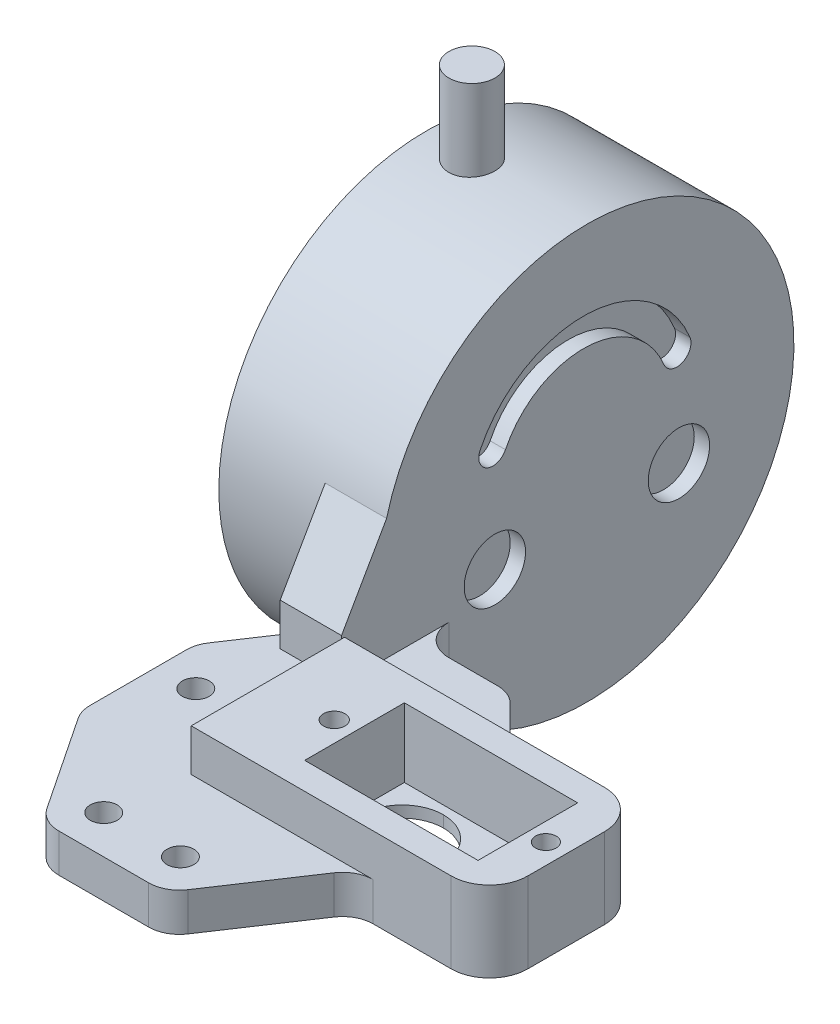
from build123d import *

# Parameters (mm, degrees)
BOSS_EXTRUDE1_DEPTH             = 5
SKETCH2_R                       = 1.75
SKETCH2_W                       = 10.8
SKETCH2_H                       = 10.8
CUT_EXTRUDE1_DEPTH              = 52.722948416
FILLET1_R                       = 5.4
FILLET2_R                       = 5.4
FILLET3_RADIUS                  = 10
FILLET3_LENGTH                  = 5
SKETCH3_W                       = 35
SKETCH3_H                       = 20
SKETCH3_W_2                     = 23
SKETCH3_H_2                     = 13
BOSS_EXTRUDE2_DEPTH             = 5.5
SKETCH4_W                       = 23
SKETCH4_H                       = 13
CUT_EXTRUDE2_DEPTH              = 3.5
CUT_EXTRUDE3_DEPTH              = 52.773674709
FILLET4_R                       = 4
SKETCH6_W                       = 8
SKETCH6_H                       = 28
BOSS_EXTRUDE3_DEPTH             = 32
FILLET5_R                       = 8
BOSS_EXTRUDE6_DEPTH             = 8
FILLET6_R                       = 4
SKETCH10_W                      = 5.3
SKETCH10_H                      = 13
SKETCH10_R                      = 1.4
BOSS_EXTRUDE7_DEPTH             = 9
BOSS_EXTRUDE8_START             = -10.5
BOSS_EXTRUDE8_DEPTH             = 10.5
SKETCH12_R                      = 1.35
CUT_EXTRUDE4_DEPTH              = 9
FILLET8_R                       = 5
SKETCH13_W                      = 4.9
SKETCH13_H                      = 13
CUT_EXTRUDE5_DEPTH              = 9
SKETCH14_R                      = 3
CUT_EXTRUDE6_DEPTH              = 71.938101594
FILLET10_R                      = 4
BOSS_EXTRUDE9_REACH             = 77.664
SKETCH15_R                      = 27
BOSS_EXTRUDE9_DIRECTION_2_DEPTH = 13
SKETCH17_R                      = 3
BOSS_EXTRUDE10_DEPTH            = 37.5
SKETCH18_R                      = 4
CUT_EXTRUDE7_DEPTH              = 2


# Some blends are built 0.0001 mm under size
with BuildPart() as part:
    # Sketch1 → Boss-Extrude1 (new body)
    with BuildSketch(Plane(origin=(0, 0, 0), x_dir=(1, 0, 0), z_dir=(0, 1, 0))):
        Polygon((45, -10), (45, 10), (21, 10), (11.001510114, 19.998489886), (-4.998489886, 19.998489886), (-14.999716743, 4.996611292), (-14.999716743, -10.003388708), (-4.998489886, -25.005267302), (11.001510114, -25.005267302), (20.99765203, -10), align=None)
    extrude(amount=BOSS_EXTRUDE1_DEPTH)

    # Sketch2 → Cut-Extrude1 (cut, through all)
    with BuildSketch(Plane(origin=(0, 5, 0), x_dir=(1, 0, 0), z_dir=(0, 1, 0))):
        with Locations(Location((-9.999716743, 0, 0), (0, 0, 270))):
            Circle(SKETCH2_R)
        with Locations(Location((-2.001032357, -20.005267302, 0), (0, 0, 270))):
            Circle(SKETCH2_R)
        with Locations(Location((7.998967643, -20.005267302, 0), (0, 0, 270))):
            Circle(SKETCH2_R)
        with Locations((16.9, 0)):
            Rectangle(SKETCH2_W, SKETCH2_H)
    extrude(amount=-CUT_EXTRUDE1_DEPTH, mode=Mode.SUBTRACT)

    # Fillet1
    fillet1_edges = [part.edges().sort_by_distance(p)[0] for p in [
        (11.5, 2.5, 5.4),
        (11.5, 2.5, -5.4),
    ]]
    fillet(fillet1_edges, radius=FILLET1_R - 0.0001)  # a hair under: the kernel refuses the full size

    # Fillet2
    # the kernel refuses this fillet: 5.4 mm, written as the material it adds along each edge
    with BuildSketch(Plane(origin=(22.3, 5, -5.4), x_dir=(0, 0, 1), z_dir=(0, -1, 0)), Plane(origin=(22.3, 5, 5.4), x_dir=(-1, 0, 0), z_dir=(0, -1, 0))) as fillet2_piece_1:
        with BuildLine():
            CenterArc((FILLET2_R, FILLET2_R), FILLET2_R, 180, 90)
            Line((0, FILLET2_R), (0, 0))
            Line((0, 0), (FILLET2_R, 0))
        make_face()
    extrude(amount=5)
    # the kernel refuses this fillet: 5.4 mm, written as the material it takes off along each edge

    # Fillet3: full round fillet: the end face becomes a half cylinder, R = half its width
    fillet3_face = Plane((45, 2.5, 0), x_dir=(0, 1, 0), z_dir=(1, 0, 0))  # on the end face: x along it, z out of the body
    fillet3_slab = fillet3_face.offset(-FILLET3_RADIUS / 2) * Box(FILLET3_LENGTH, 2 * FILLET3_RADIUS, FILLET3_RADIUS, mode=Mode.PRIVATE)  # the body's end, R deep
    fillet3_round = Plane((35, 2.5, 0), x_dir=(1, 0, 0), z_dir=(0, 1, 0)) * Cylinder(FILLET3_RADIUS, FILLET3_LENGTH, mode=Mode.PRIVATE)  # its axis R under the face
    add(fillet3_slab - fillet3_round, mode=Mode.SUBTRACT)

    # Sketch3 → Boss-Extrude2 (add)
    with BuildSketch(Plane(origin=(0, 5, 0), x_dir=(1, 0, 0), z_dir=(0, 1, 0))):
        with Locations((16.9, 0)):
            Rectangle(SKETCH3_W, SKETCH3_H)
        with Locations((16.9, 0)):
            Rectangle(SKETCH3_W_2, SKETCH3_H_2, mode=Mode.SUBTRACT)
    extrude(amount=BOSS_EXTRUDE2_DEPTH)

    # Sketch4 → Cut-Extrude2 (cut)
    with BuildSketch(Plane(origin=(0, 5, 0), x_dir=(1, 0, 0), z_dir=(0, 1, 0))):
        with Locations((16.9, 0)):
            Rectangle(SKETCH4_W, SKETCH4_H)
    extrude(amount=-CUT_EXTRUDE2_DEPTH, mode=Mode.SUBTRACT)

    # Sketch5 → Cut-Extrude3 (cut, through all)
    with BuildSketch(Plane(origin=(0, 5, 0), x_dir=(1, 0, 0), z_dir=(0, 1, 0))):
        with BuildLine():
            Line((34.4, 10), (34.4, -10))
            Line((34.4, -10), (35, -10))
            ThreePointArc((35, -10), (45, 0), (35, 10))
            Line((35, 10), (34.4, 10))
        make_face()
    extrude(amount=-CUT_EXTRUDE3_DEPTH, mode=Mode.SUBTRACT)

    # Fillet4
    fillet4_edges = [part.edges().sort_by_distance(p)[0] for p in [
        (34.4, 5.25, 10),
        (34.4, 5.25, -10),
    ]]
    fillet(fillet4_edges, radius=FILLET4_R)

    # Sketch6 → Boss-Extrude3 (add)
    with BuildSketch(Plane(origin=(0, 0, -19.998489886), x_dir=(-1, 0, 0), z_dir=(0, 0, -1))):
        with Locations((4.998489886, 14)):
            Rectangle(SKETCH6_W, SKETCH6_H)
    extrude(amount=BOSS_EXTRUDE3_DEPTH)

    # Fillet5
    fillet5_edges = [part.edges().sort_by_distance(p)[0] for p in [
        (-4.998489886, 0, -51.998489886),
        (-4.998489886, 28, -51.998489886),
    ]]
    fillet(fillet5_edges, radius=FILLET5_R)

    # Sketch9 → Boss-Extrude6 (add)
    with BuildSketch(Plane.ZY.offset(8.998489886)):
        Polygon((-10, 10.5), (-19.998489886, 28), (-19.998489886, 0), (-10, 0), align=None)
    extrude(amount=-BOSS_EXTRUDE6_DEPTH)

    # Fillet6
    fillet6_edges = [part.edges().sort_by_distance(p)[0] for p in [
        (-0.998489886, 2.5, -19.998489886),
        (20.99765203, 2.5, 10),
        (11.001510114, 2.5, 25.005267302),
        (-4.998489886, 2.5, 25.005267302),
        (-14.999716743, 2.5, 10.003388708),
        (-14.999716743, 2.5, -4.996611292),
        (11.001510114, 2.5, -19.998489886),
        (21, 2.5, -10),
        (-8.998489886, 2.5, -13.998474565),
    ]]
    fillet(fillet6_edges, radius=FILLET6_R)

    # Sketch10 → Boss-Extrude7 (add)
    with BuildSketch(Plane(origin=(0, 1.5, 0), x_dir=(1, 0, 0), z_dir=(0, 1, 0))):
        with Locations((8.05, 0)):
            Rectangle(SKETCH10_W, SKETCH10_H)
        with Locations(Location((8.05, 0, 0), (0, 0, 90))):
            Circle(SKETCH10_R, mode=Mode.SUBTRACT)
    extrude(amount=BOSS_EXTRUDE7_DEPTH)

    # Sketch11 → Boss-Extrude8 (add)
    with BuildSketch(Plane(origin=(0, 10.5, 0), x_dir=(1, 0, 0), z_dir=(0, 1, 0)).offset(BOSS_EXTRUDE8_START)):
        with BuildLine():
            Line((30.4, 10), (38.3, 10))
            Line((38.3, 10), (38.3, -10))
            Line((38.3, -10), (30.4, -10))
            ThreePointArc((30.4, -10), (33.228427125, -8.828427125), (34.4, -6))
            Line((34.4, -6), (34.4, 6))
            ThreePointArc((34.4, 6), (33.228427125, 8.828427125), (30.4, 10))
        make_face()
    extrude(amount=BOSS_EXTRUDE8_DEPTH)

    # Sketch12 → Cut-Extrude4 (cut)
    with BuildSketch(Plane(origin=(0, 10.5, 0), x_dir=(1, 0, 0), z_dir=(0, 1, 0))):
        with Locations(Location((35.65, 0, 0), (0, 0, 270))):
            Circle(SKETCH12_R)
    extrude(amount=-CUT_EXTRUDE4_DEPTH, mode=Mode.SUBTRACT)

    # Fillet8
    fillet8_edges = [part.edges().sort_by_distance(p)[0] for p in [
        (38.3, 5.25, -10),
        (38.3, 5.25, 10),
    ]]
    fillet(fillet8_edges, radius=FILLET8_R)

    # Sketch13 → Cut-Extrude5 (cut)
    with BuildSketch(Plane(origin=(0, 10.5, 0), x_dir=(1, 0, 0), z_dir=(0, 1, 0))):
        with Locations((30.85, 0)):
            Rectangle(SKETCH13_W, SKETCH13_H)
    extrude(amount=-CUT_EXTRUDE5_DEPTH, mode=Mode.SUBTRACT)

    # Sketch14 → Cut-Extrude6 (cut, through all)
    with BuildSketch(Plane(origin=(-0.998489886, 0, 0), x_dir=(0, 0, -1), z_dir=(1, 0, 0))):
        with Locations((41, 22)):
            Circle(SKETCH14_R)
        with Locations((41, 6)):
            Circle(SKETCH14_R)
    extrude(amount=-CUT_EXTRUDE6_DEPTH, mode=Mode.SUBTRACT)

    # Fillet10
    fillet10_edges = [part.edges().sort_by_distance(p)[0] for p in [
        (-4.998489886, 28, -19.998489886),
    ]]
    fillet(fillet10_edges, radius=FILLET10_R)

    # Boss-Extrude9: up to this face of the body (flat: up to its plane)
    boss_extrude9_end = Plane(part.part.faces().sort_by_distance((-0.998489886, 14.084187899, -32.543371898))[0])
    # Sketch15 → Boss-Extrude9 (add, up to the picked face)
    with BuildSketch(Plane.ZY.offset(8.998489886), mode=Mode.PRIVATE) as boss_extrude9_sk1:
        with Locations(Location((-41.998489886, 13.958456326, 0), (0, 0, 328.870116099))):
            Circle(SKETCH15_R)
    boss_extrude9_tool1 = split(extrude(boss_extrude9_sk1.sketch, amount=-BOSS_EXTRUDE9_REACH, mode=Mode.PRIVATE), bisect_by=boss_extrude9_end, keep=Keep.BOTH, mode=Mode.PRIVATE)
    add(boss_extrude9_tool1.solids().sort_by(Axis((-8.99849, 13.958456, -41.99849), (1, 0, 0)))[0])

    # Sketch15 → Boss-Extrude9 direction 2 (add)
    with BuildSketch(Plane.ZY.offset(8.998489886)):
        with Locations(Location((-41.998489886, 13.958456326, 0), (0, 0, 328.870116099))):
            Circle(SKETCH15_R)
    extrude(amount=BOSS_EXTRUDE9_DIRECTION_2_DEPTH)

    # Sketch17 → Boss-Extrude10 (add, symmetric)
    with BuildSketch(Plane(origin=(0, 13.958456326, 0), x_dir=(1, 0, 0), z_dir=(0, 1, 0))):
        with Locations(Location((-15.998489886, 41.998489886, 0), (0, 0, 90))):
            Circle(SKETCH17_R)
    extrude(amount=BOSS_EXTRUDE10_DEPTH, both=True)

    # Sketch18 → Cut-Extrude7 (cut)
    with BuildSketch(Plane(origin=(-0.998489886, 0, 0), x_dir=(0, 0, -1), z_dir=(1, 0, 0))):
        with Locations((53.998489886, 7.958456326)):
            Circle(SKETCH18_R)
        with Locations((29.998489886, 7.958456326)):
            Circle(SKETCH18_R)
        with BuildLine():
            ThreePointArc((55.430471337, 21.482233331), (42.06121766, 30.791596739), (28.086871666, 22.41789714))
            ThreePointArc((28.086871666, 22.41789714), (28.923742357, 19.962632481), (31.379007016, 20.799503173))
            ThreePointArc((31.379007016, 20.799503173), (41.935762112, 27.125315913), (52.035407344, 20.092666969))
            ThreePointArc((52.035407344, 20.092666969), (54.427722522, 19.089918153), (55.430471337, 21.482233331))
        make_face()
    extrude(amount=-CUT_EXTRUDE7_DEPTH, mode=Mode.SUBTRACT)


solid = part.part
